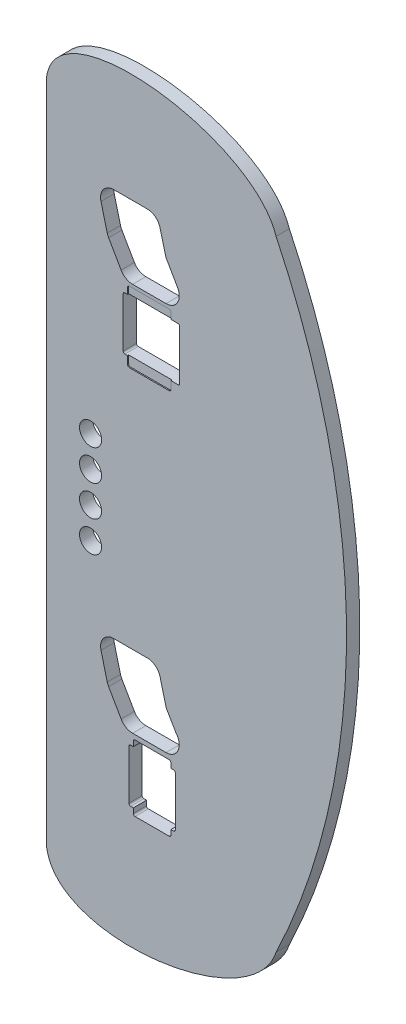
from build123d import *

# Parameters (mm, degrees)
SKETCH4_R           = 15.875
BOSS_EXTRUDE6_DEPTH = 19.05
BOSS_EXTRUDE7_DEPTH = 17.4625


with BuildPart() as part:
    # Sketch4 → Boss-Extrude6 (new body)
    with BuildSketch(Plane.XY):
        with BuildLine():
            add(Edge.make_bspline(
                [(1691.296561672, 1918.177904127), (1656.762851887, 2023.18607917), (1371.325091688, 2058.930160841), (1361.096561672, 1948.863494174)],
                knots=[0, 0, 0, 0, 7.638294788, 7.638294788, 7.638294788, 7.638294788], degree=3))
            Line((1361.096561672, 1948.863494174), (1361.096561672, 996.363494174))
            add(Edge.make_bspline(
                [(1691.296561672, 1027.049084222), (1656.707719979, 922.059056278), (1371.325091688, 886.296827508), (1361.096561672, 996.363494174)],
                knots=[0, 0, 0, 0, 7.629784399, 7.629784399, 7.629784399, 7.629784399], degree=3))
            ThreePointArc((1691.296561672, 1027.049084222), (1792.519416014, 1472.613494174), (1691.296561672, 1918.177904127))
        make_face()
        with BuildLine():
            Line((1488.60074179, 1189.913462674), (1513.04824179, 1189.913462674))
            Line((1513.04824179, 1189.913462674), (1537.49574179, 1189.913462674))
            ThreePointArc((1537.49574179, 1189.913462674), (1539.291793014, 1189.169513898), (1540.03574179, 1187.373462674))
            Line((1540.03574179, 1187.373462674), (1540.03574179, 1180.388462674))
            Line((1540.03574179, 1180.388462674), (1543.84574179, 1180.388462674))
            ThreePointArc((1543.84574179, 1180.388462674), (1545.641793014, 1179.644513898), (1546.38574179, 1177.848462674))
            Line((1546.38574179, 1177.848462674), (1546.38574179, 1106.728462674))
            ThreePointArc((1546.38574179, 1106.728462674), (1545.641793014, 1104.93241145), (1543.84574179, 1104.188462674))
            Line((1543.84574179, 1104.188462674), (1540.03574179, 1104.188462674))
            Line((1540.03574179, 1104.188462674), (1540.03574179, 1097.203462674))
            ThreePointArc((1540.03574179, 1097.203462674), (1539.291793014, 1095.40741145), (1537.49574179, 1094.663462674))
            Line((1537.49574179, 1094.663462674), (1488.60074179, 1094.663462674))
            ThreePointArc((1488.60074179, 1094.663462674), (1486.804690566, 1095.40741145), (1486.06074179, 1097.203462674))
            Line((1486.06074179, 1097.203462674), (1486.06074179, 1104.188462674))
            Line((1486.06074179, 1104.188462674), (1482.25074179, 1104.188462674))
            ThreePointArc((1482.25074179, 1104.188462674), (1480.454690566, 1104.93241145), (1479.71074179, 1106.728462674))
            Line((1479.71074179, 1106.728462674), (1479.71074179, 1177.848462674))
            ThreePointArc((1479.71074179, 1177.848462674), (1480.454690566, 1179.644513898), (1482.25074179, 1180.388462674))
            Line((1482.25074179, 1180.388462674), (1486.06074179, 1180.388462674))
            Line((1486.06074179, 1180.388462674), (1486.06074179, 1187.373462674))
            ThreePointArc((1486.06074179, 1187.373462674), (1486.804690566, 1189.169513898), (1488.60074179, 1189.913462674))
        make_face(mode=Mode.SUBTRACT)
        with Locations((1424.596561672, 1405.938494174)):
            Circle(SKETCH4_R, mode=Mode.SUBTRACT)
        with Locations((1424.596561672, 1450.388494174)):
            Circle(SKETCH4_R, mode=Mode.SUBTRACT)
        with BuildLine():
            Line((1448.599054653, 1242.069282307), (1439.599047253, 1277.069212307))
            ThreePointArc((1439.599047253, 1277.069212307), (1443.530372909, 1294.147019672), (1459.747970005, 1300.787529462))
            Line((1459.747970005, 1300.787529462), (1504.349628175, 1300.787529462))
            ThreePointArc((1504.349628175, 1300.787529462), (1517.03821718, 1297.374125496), (1524.498550926, 1286.557701042))
            Line((1524.498550926, 1286.557701042), (1533.38304498, 1252.006988342))
            Line((1533.38304498, 1252.006988342), (1547.541432032, 1227.927383263))
            ThreePointArc((1547.541432032, 1227.927383263), (1549.470421095, 1225.219175121), (1550.899143934, 1222.21681918))
            ThreePointArc((1550.899143934, 1222.21681918), (1548.695609175, 1204.697126576), (1533.04876059, 1196.513525674))
            Line((1533.04876059, 1196.513525674), (1513.04824179, 1196.513525674))
            Line((1513.04824179, 1196.513525674), (1485.04883119, 1196.513525674))
            ThreePointArc((1485.04883119, 1196.513525674), (1475.515471645, 1199.070570942), (1468.54140154, 1206.0552521))
            Line((1468.54140154, 1206.0552521), (1450.54141214, 1237.3052531))
            ThreePointArc((1450.54141214, 1237.3052531), (1449.408667615, 1239.621395205), (1448.599054653, 1242.069282307))
        make_face(mode=Mode.SUBTRACT)
        with Locations((1424.596561672, 1494.838494174)):
            Circle(SKETCH4_R, mode=Mode.SUBTRACT)
        with Locations((1424.596561672, 1539.288494174)):
            Circle(SKETCH4_R, mode=Mode.SUBTRACT)
        with BuildLine():
            Line((1540.03574179, 1739.188462674), (1550.19574179, 1739.188462674))
            ThreePointArc((1550.19574179, 1739.188462674), (1551.991793014, 1738.444513898), (1552.73574179, 1736.648462674))
            Line((1552.73574179, 1736.648462674), (1552.73574179, 1665.528462674))
            ThreePointArc((1552.73574179, 1665.528462674), (1551.991793014, 1663.73241145), (1550.19574179, 1662.988462674))
            Line((1550.19574179, 1662.988462674), (1540.03574179, 1662.988462674))
            Line((1540.03574179, 1662.988462674), (1540.03574179, 1651.742555786))
            ThreePointArc((1540.03574179, 1651.742555786), (1539.291793014, 1649.946504562), (1537.49574179, 1649.202555786))
            Line((1537.49574179, 1649.202555786), (1480.34574179, 1649.202555786))
            ThreePointArc((1480.34574179, 1649.202555786), (1478.549690566, 1649.946504562), (1477.80574179, 1651.742555786))
            Line((1477.80574179, 1651.742555786), (1477.80574179, 1662.988462674))
            Line((1477.80574179, 1662.988462674), (1473.99574179, 1662.988462674))
            ThreePointArc((1473.99574179, 1662.988462674), (1472.199690566, 1663.73241145), (1471.45574179, 1665.528462674))
            Line((1471.45574179, 1665.528462674), (1471.45574179, 1736.648462674))
            ThreePointArc((1471.45574179, 1736.648462674), (1472.199690566, 1738.444513898), (1473.99574179, 1739.188462674))
            Line((1473.99574179, 1739.188462674), (1477.80574179, 1739.188462674))
            Line((1477.80574179, 1739.188462674), (1477.80574179, 1748.262555786))
            ThreePointArc((1477.80574179, 1748.262555786), (1478.549690566, 1750.05860701), (1480.34574179, 1750.802555786))
            Line((1480.34574179, 1750.802555786), (1537.49574179, 1750.802555786))
            ThreePointArc((1537.49574179, 1750.802555786), (1539.291793014, 1750.05860701), (1540.03574179, 1748.262555786))
            Line((1540.03574179, 1748.262555786), (1540.03574179, 1739.188462674))
        make_face(mode=Mode.SUBTRACT)
        with BuildLine():
            Line((1448.599054653, 1800.869282307), (1439.599047253, 1835.869212307))
            ThreePointArc((1439.599047253, 1835.869212307), (1442.994261078, 1852.286602026), (1458.04883439, 1859.663456674))
            Line((1458.04883439, 1859.663456674), (1506.04876379, 1859.663456674))
            ThreePointArc((1506.04876379, 1859.663456674), (1517.721909142, 1855.668029986), (1524.498550926, 1845.357701042))
            Line((1524.498550926, 1845.357701042), (1532.852004601, 1812.872139543))
            Line((1532.852004601, 1812.872139543), (1549.556190239, 1783.871799249))
            ThreePointArc((1549.556190239, 1783.871799249), (1549.541715322, 1764.83016613), (1533.04876059, 1755.313525674))
            Line((1533.04876059, 1755.313525674), (1485.04883119, 1755.313525674))
            ThreePointArc((1485.04883119, 1755.313525674), (1475.515471645, 1757.870570942), (1468.54140154, 1764.8552521))
            Line((1468.54140154, 1764.8552521), (1450.54141214, 1796.1052531))
            ThreePointArc((1450.54141214, 1796.1052531), (1449.408667615, 1798.421395205), (1448.599054653, 1800.869282307))
        make_face(mode=Mode.SUBTRACT)
    extrude(amount=BOSS_EXTRUDE6_DEPTH)

    # Sketch15 → Boss-Extrude7 (add)
    with BuildSketch(Plane.XY):
        with BuildLine():
            Line((1477.80574179, 1739.188462674), (1540.03574179, 1739.188462674))
            Line((1540.03574179, 1739.188462674), (1540.03574179, 1748.262555786))
            ThreePointArc((1540.03574179, 1748.262555786), (1539.291793014, 1750.05860701), (1537.49574179, 1750.802555786))
            Line((1537.49574179, 1750.802555786), (1480.34574179, 1750.802555786))
            ThreePointArc((1480.34574179, 1750.802555786), (1478.549690566, 1750.05860701), (1477.80574179, 1748.262555786))
            Line((1477.80574179, 1748.262555786), (1477.80574179, 1739.188462674))
        make_face()
        with BuildLine():
            Line((1540.03574179, 1651.742555786), (1540.03574179, 1662.988462674))
            Line((1540.03574179, 1662.988462674), (1477.80574179, 1662.988462674))
            Line((1477.80574179, 1662.988462674), (1477.80574179, 1651.742555786))
            ThreePointArc((1477.80574179, 1651.742555786), (1478.549690566, 1649.946504562), (1480.34574179, 1649.202555786))
            Line((1480.34574179, 1649.202555786), (1537.49574179, 1649.202555786))
            ThreePointArc((1537.49574179, 1649.202555786), (1539.291793014, 1649.946504562), (1540.03574179, 1651.742555786))
        make_face()
    extrude(amount=BOSS_EXTRUDE7_DEPTH)


solid = part.part
